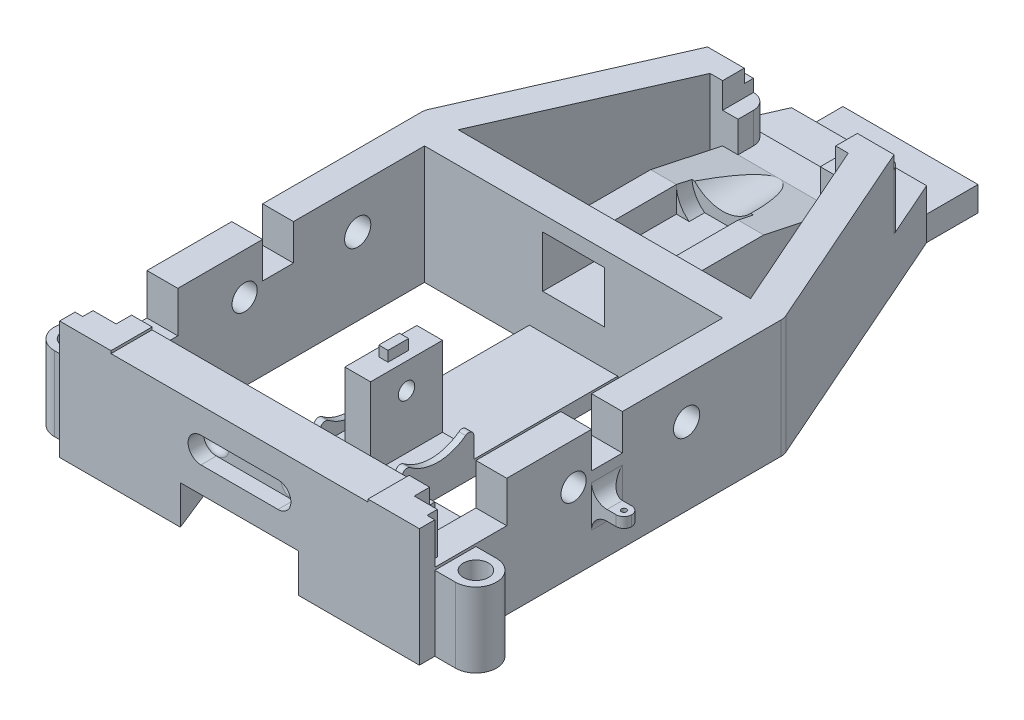
from build123d import *

# Parameters (mm, degrees)
SKETCH1_W                = 58
SKETCH1_H                = 65
BOSS_EXTRUDE1_DEPTH      = 30
BOSS_EXTRUDE3_REACH      = 92.09
SKETCH10_W               = 5
SKETCH10_H               = 14
CUT_EXTRUDE1_REACH       = 111.372
SKETCH2_R                = 2.45
SKETCH2_R_2              = 2.55
CUT_EXTRUDE2_REACH       = 91.744
SKETCH3_W                = 12
SKETCH3_H                = 10
SKETCH11_W               = 3
SKETCH11_H               = 2
BOSS_EXTRUDE4_DEPTH      = 6.3
FILLET3_R                = 1.5
SKETCH12_R               = 0.5
CUT_EXTRUDE3_DEPTH       = 92.15338732
FILLET3_OF_MIRROR1_R     = 1.5
BOSS_EXTRUDE5_REACH      = 111.564
SKETCH13_W               = 15
SKETCH13_H               = 6
BOSS_EXTRUDE6_REACH      = 111.564
SKETCH17_W               = 15
SKETCH17_H               = 14
CUT_EXTRUDE18_REACH      = 129.651
SKETCH35_W               = 16
SKETCH35_H               = 6
FILLET5_R                = 3
BOSS_EXTRUDE7_START      = 20
BOSS_EXTRUDE7_DEPTH      = 10
BOSS_EXTRUDE8_DEPTH      = 20
CUT_EXTRUDE15_REACH      = 95.637
SKETCH28_R               = 0.8
FILLET4_R                = 3
CUT_EXTRUDE16_REACH      = 96.767
SKETCH29_R               = 1.6
SKETCH30_W               = 14
SKETCH30_H               = 1.5
BOSS_EXTRUDE9_DEPTH      = 6.1
SKETCH31_W               = 1.3
SKETCH31_H               = 14
BOSS_EXTRUDE10_DEPTH     = 5
CUT_EXTRUDE17_REACH      = 99.736
FILLET11_R               = 1
FILLET11_OF_MIRROR4_R    = 1
MIRROR5_START            = -8.6
MIRROR5_OUTLINE_W        = 1.5
MIRROR5_OUTLINE_H        = 14
MIRROR5_DEPTH            = 17.2
MIRROR5_START_2          = 7.3
MIRROR5_2_DEPTH          = 1.3
SKETCH36_W               = 22
SKETCH36_H               = 15
BOSS_EXTRUDE12_DEPTH     = 14
CUT_EXTRUDE19_DEPTH      = 3
CUT_EXTRUDE20_DEPTH      = 11
CUT_EXTRUDE21_REACH      = 100.983
SKETCH41_W               = 3
SKETCH41_H               = 35
BOSS_EXTRUDE13_DEPTH     = 2
BOSS_EXTRUDE14_START     = -1.789079
SKETCH43_W               = 36.284482562
SKETCH43_H               = 9.6
BOSS_EXTRUDE14_DEPTH     = 66.789079
BOSS_EXTRUDE15_REACH     = 152.996
SKETCH44_W               = 2.842240903
SKETCH44_H               = 50
FILLET6_R                = 8
FILLET7_R                = 5
SKETCH45_W               = 17
SKETCH45_H               = 8
CUT_EXTRUDE22_DEPTH      = 166.644015889
BOSS_EXTRUDE16_REACH     = 152.29
SKETCH46_W               = 4.5
SKETCH46_H               = 5
BOSS_EXTRUDE17_START     = -30
BOSS_EXTRUDE17_DEPTH     = 30
SKETCH49_W               = 8
SKETCH49_H               = 9
CUT_EXTRUDE23_DEPTH      = 8
SKETCH50_R               = 2.45
CUT_EXTRUDE24_DEPTH      = 4.5
CUT_EXTRUDE25_START      = 13.5
SKETCH51_R               = 2.45
CUT_EXTRUDE25_DEPTH      = 4.5
BOSS_EXTRUDE18_REACH     = 165.708
SKETCH53_W               = 5
SKETCH53_H               = 10
SKETCH55_W               = 58
SKETCH55_H               = 10
BOSS_EXTRUDE20_DEPTH     = 4
CUT_EXTRUDE9_START       = -10
SKETCH19_W               = 30
SKETCH19_H               = 15
CUT_EXTRUDE9_DEPTH       = 10
SKETCH58_W               = 70
SKETCH58_H               = 9
CUT_EXTRUDE27_DEPTH      = 153.77843439
BOSS_EXTRUDE22_REACH     = 153.411
SKETCH59_W               = 30
SKETCH59_H               = 5
CUT_EXTRUDE28_REACH      = 183.113
SKETCH18_R               = 1.5
FILLET9_R                = 2
FILLET10_R               = 1
SKETCH60_W               = 70
SKETCH60_H               = 3
BOSS_EXTRUDE23_DEPTH     = 30
CUT_EXTRUDE29_DEPTH      = 7.5
CUT_EXTRUDE30_DEPTH      = 3
SKETCH64_W               = 58
SKETCH64_H               = 4
BOSS_EXTRUDE24_DEPTH     = 6
CUT_EXTRUDE31_DEPTH      = 7.5
CUT_EXTRUDE32_DEPTH      = 153.77843439
SKETCH66_W               = 26.284482562
SKETCH66_H               = 4.8
BOSS_EXTRUDE25_DEPTH     = 10
CUT_EXTRUDE33_DEPTH      = 130.30845238
CUT_EXTRUDE33_DEPTH_BACK = 130.30845238
SKETCH74_W               = 130.544253953
SKETCH74_H               = 9
SKETCH75_W               = 50
SKETCH75_H               = 0.5
CUT_EXTRUDE34_DEPTH      = 37
SKETCH76_W               = 21.333332958
SKETCH76_H               = 2.6
CUT_EXTRUDE35_DEPTH      = 128.380044971
CUT_EXTRUDE36_DEPTH      = 128.380044971
CUT_EXTRUDE36_DEPTH_BACK = 6
SKETCH77_W               = 6
SKETCH77_H               = 7
CUT_EXTRUDE37_DEPTH      = 128.380044971
CUT_EXTRUDE37_DEPTH_BACK = 6
SKETCH78_W               = 6
SKETCH78_H               = 7
CUT_EXTRUDE39_DEPTH      = 110.39801577
CUT_EXTRUDE39_DEPTH_BACK = 2.5
CUT_EXTRUDE40_DEPTH      = 3
SKETCH82_W               = 22.000000438
SKETCH82_H               = 25.54425399
CUT_EXTRUDE41_DEPTH      = 5
SKETCH83_W               = 1.8
SKETCH83_H               = 4
BOSS_EXTRUDE26_DEPTH     = 2


with BuildPart() as part:
    # Sketch1 → Boss-Extrude1 (new body)
    with BuildSketch(Plane(origin=(0, 0, 0), x_dir=(1, 0, 0), z_dir=(0, 1, 0))):
        Polygon((-35, 38.5), (-17.352941176, 78.5), (17.352941947, 78.5), (35, 38.5), (35, -38.5), (-35, -38.5), align=None)
        Rectangle(SKETCH1_W, SKETCH1_H, mode=Mode.SUBTRACT)
        Polygon((-28.44203382, 38.5), (28.442033867, 38.5), (13.442034522, 72.5), (-13.44203382, 72.5), align=None, mode=Mode.SUBTRACT)
    extrude(amount=BOSS_EXTRUDE1_DEPTH)

    # Sketch7 → Loft3 section 0
    with BuildSketch(Plane.XY.offset(-32.5)):
        with BuildLine():
            Line((-8.6, 30), (8.6, 30))
            Line((8.6, 30), (8.6, 27))
            Line((8.6, 27), (-8.6, 27))
            Line((-8.6, 27), (-8.6, 30))
        make_face()
    # Sketch8 → Loft3 section 1
    with BuildSketch(Plane.XY.offset(38.5)):
        with BuildLine():
            Line((-8.6, 30), (8.6, 30))
            Line((8.6, 30), (8.6, 27))
            Line((8.6, 27), (-8.6, 27))
            Line((-8.6, 27), (-8.6, 30))
        make_face()
    loft3 = loft()

    # Mirror3: Loft3 across plane
    add(loft3.mirror(Plane(origin=(0, 15, 0), x_dir=(0, 0, 1), z_dir=(0, -1, 0))))

    # Sketch10 → Boss-Extrude3 (add, up to next)
    with BuildSketch(Plane.XZ.offset(-27), mode=Mode.PRIVATE) as boss_extrude3_sk1:
        with Locations((0, 2.5)):
            Rectangle(SKETCH10_W, SKETCH10_H)
    boss_extrude3_tool1 = extrude(boss_extrude3_sk1.sketch, amount=BOSS_EXTRUDE3_REACH, mode=Mode.PRIVATE) - part.part
    add(boss_extrude3_tool1.solids().sort_by_distance((0, 27, 2.5))[0])

    # Sketch2 → Cut-Extrude1 (cut, up to next)
    with BuildSketch(Plane(origin=(35, 0, 0), x_dir=(0, 0, -1), z_dir=(1, 0, 0)), mode=Mode.PRIVATE) as cut_extrude1_sk1:
        with Locations((-2.5, 15)):
            Circle(SKETCH2_R)
    cut_extrude1_tool1 = extrude(cut_extrude1_sk1.sketch, amount=-CUT_EXTRUDE1_REACH, mode=Mode.PRIVATE) & part.part
    # Sketch2 → Cut-Extrude1 (cut, up to next)
    with BuildSketch(Plane(origin=(35, 0, 0), x_dir=(0, 0, -1), z_dir=(1, 0, 0)), mode=Mode.PRIVATE) as cut_extrude1_sk2:
        with Locations((19.5, 15)):
            Circle(SKETCH2_R_2)
    cut_extrude1_tool2 = extrude(cut_extrude1_sk2.sketch, amount=-CUT_EXTRUDE1_REACH, mode=Mode.PRIVATE) & part.part
    cut_extrude1_1 = cut_extrude1_tool1.solids().sort_by_distance((35, 15, 2.5))[0]
    add(cut_extrude1_1, mode=Mode.SUBTRACT)
    cut_extrude1_2 = cut_extrude1_tool2.solids().sort_by_distance((35, 15, -19.5))[0]
    add(cut_extrude1_2, mode=Mode.SUBTRACT)
    cut_extrude1 = cut_extrude1_1 + cut_extrude1_2  # Cut-Extrude1 as one shape, for the pattern or mirror that repeats it

    # Sketch3 → Cut-Extrude2 (cut, up to next)
    with BuildSketch(Plane(origin=(0, 0, -38.5), x_dir=(-1, 0, 0), z_dir=(0, 0, -1)), mode=Mode.PRIVATE) as cut_extrude2_sk1:
        with Locations((0, 15)):
            Rectangle(SKETCH3_W, SKETCH3_H)
    cut_extrude2_tool1 = extrude(cut_extrude2_sk1.sketch, amount=-CUT_EXTRUDE2_REACH, mode=Mode.PRIVATE) & part.part
    add(cut_extrude2_tool1.solids().sort_by_distance((0, 15, -38.5))[0], mode=Mode.SUBTRACT)

    # Sketch11 → Boss-Extrude4 (add)
    with BuildSketch(Plane(origin=(35, 0, 0), x_dir=(0, 0, -1), z_dir=(1, 0, 0))):
        with Locations((2.5, 20)):
            Rectangle(SKETCH11_W, SKETCH11_H)
        with Locations((2.5, 10)):
            Rectangle(SKETCH11_W, SKETCH11_H)
    boss_extrude4 = extrude(amount=BOSS_EXTRUDE4_DEPTH)

    # Fillet3
    fillet3_edges = [part.edges().sort_by_distance(p)[0] for p in [
        (41.3, 10, -1),
        (41.3, 10, -4),
        (41.3, 20, -1),
        (41.3, 20, -4),
    ]]
    fillet(fillet3_edges, radius=FILLET3_R - 0.0001)  # a hair under: the kernel refuses the full size

    # Sketch12 → Cut-Extrude3 (cut, through all)
    with BuildSketch(Plane(origin=(0, 21, 0), x_dir=(1, 0, 0), z_dir=(0, 1, 0))):
        with Locations(Location((39.8, 2.5, 0), (0, 0, 270))):
            Circle(SKETCH12_R)
    cut_extrude3 = extrude(amount=-CUT_EXTRUDE3_DEPTH, mode=Mode.SUBTRACT)

    # Mirror1: Cut-Extrude1, Boss-Extrude4, Cut-Extrude3 across plane
    add(cut_extrude1.mirror(Plane(origin=(0, 0, 0), x_dir=(0, 0, 1), z_dir=(1, 0, 0))), mode=Mode.SUBTRACT)
    add(boss_extrude4.mirror(Plane(origin=(0, 0, 0), x_dir=(0, 0, 1), z_dir=(1, 0, 0))))
    add(cut_extrude3.mirror(Plane(origin=(0, 0, 0), x_dir=(0, 0, 1), z_dir=(1, 0, 0))), mode=Mode.SUBTRACT)

    # Fillet3 of Mirror1
    fillet3_of_mirror1_edges = [part.edges().sort_by_distance(p)[0] for p in [
        (-41.3, 10, -1),
        (-41.3, 10, -4),
        (-41.3, 20, -1),
        (-41.3, 20, -4),
    ]]
    fillet(fillet3_of_mirror1_edges, radius=FILLET3_OF_MIRROR1_R - 0.0001)  # a hair under: the kernel refuses the full size

    # Sketch13 → Boss-Extrude5 (add, up to next)
    with BuildSketch(Plane(origin=(-29, 0, 0), x_dir=(0, 0, -1), z_dir=(1, 0, 0)), mode=Mode.PRIVATE) as boss_extrude5_sk1:
        with Locations((-25, 27)):
            Rectangle(SKETCH13_W, SKETCH13_H)
    boss_extrude5_tool1 = extrude(boss_extrude5_sk1.sketch, amount=BOSS_EXTRUDE5_REACH, mode=Mode.PRIVATE) - part.part
    add(boss_extrude5_tool1.solids().sort_by_distance((-29, 27, 25))[0])

    # Sketch17 → Boss-Extrude6 (add, up to next)
    with BuildSketch(Plane(origin=(-29, 0, 0), x_dir=(0, 0, -1), z_dir=(1, 0, 0)), mode=Mode.PRIVATE) as boss_extrude6_sk1:
        with Locations((-25, 7)):
            Rectangle(SKETCH17_W, SKETCH17_H)
    boss_extrude6_tool1 = extrude(boss_extrude6_sk1.sketch, amount=BOSS_EXTRUDE6_REACH, mode=Mode.PRIVATE) - part.part
    add(boss_extrude6_tool1.solids().sort_by_distance((-29, 7, 25))[0])

    # Sketch35 → Cut-Extrude18 (cut, up to next)
    with BuildSketch(Plane(origin=(0, 0, -78.5), x_dir=(-1, 0, 0), z_dir=(0, 0, -1)), mode=Mode.PRIVATE) as cut_extrude18_sk1:
        with Locations((0, 15)):
            Rectangle(SKETCH35_W, SKETCH35_H)
    cut_extrude18_tool1 = extrude(cut_extrude18_sk1.sketch, amount=-CUT_EXTRUDE18_REACH, mode=Mode.PRIVATE) & part.part
    add(cut_extrude18_tool1.solids().sort_by_distance((0, 15, -78.5))[0], mode=Mode.SUBTRACT)

    # Fillet5
    fillet5_edges = [part.edges().sort_by_distance(p)[0] for p in [
        (-35, 15, -38.5),
        (-17.352941176, 15, -78.5),
        (17.352941947, 15, -78.5),
        (35, 15, -38.5),
        (-8, 15, -78.5),
        (8, 15, -78.5),
    ]]
    fillet(fillet5_edges, radius=FILLET5_R)

    # Sketch24 → Boss-Extrude7 (add)
    with BuildSketch(Plane(origin=(0, 0, 0), x_dir=(1, 0, 0), z_dir=(0, 1, 0)).offset(BOSS_EXTRUDE7_START)):
        Polygon((9.15, 49.5), (9.15, 72.5), (6.15, 72.5), (6.15, 49.5), (-6.15, 49.5), (-6.15, 72.5), (-9.15, 72.5), (-9.15, 49.5), (-23.589092644, 49.5), (-26.23615161, 43.5), (26.23615161, 43.5), (23.589092902, 49.5), align=None)
    extrude(amount=BOSS_EXTRUDE7_DEPTH)

    # Sketch26 → Boss-Extrude8 (add)
    with BuildSketch(Plane(origin=(0, 0, -38.5), x_dir=(-1, 0, 0), z_dir=(0, 0, -1))):
        Polygon((-11, 5), (-11, 0), (11, 0), (11, 5), (11, 15), (6, 15), (6, 10), (-6, 10), (-6, 15), (-11, 15), align=None)
    extrude(amount=BOSS_EXTRUDE8_DEPTH)

    # Sketch28 → Cut-Extrude15 (cut, up to next)
    with BuildSketch(Plane(origin=(0, 30, 0), x_dir=(-1, 0, 0), z_dir=(0, 1, 0)), mode=Mode.PRIVATE) as cut_extrude15_sk1:
        with Locations(Location((0, -46.5, 0), (0, 0, 90))):
            Circle(SKETCH28_R)
    cut_extrude15_tool1 = extrude(cut_extrude15_sk1.sketch, amount=-CUT_EXTRUDE15_REACH, mode=Mode.PRIVATE) & part.part
    # Sketch28 → Cut-Extrude15 (cut, up to next)
    with BuildSketch(Plane(origin=(0, 30, 0), x_dir=(-1, 0, 0), z_dir=(0, 1, 0)), mode=Mode.PRIVATE) as cut_extrude15_sk2:
        with Locations(Location((0, -75.5, 0), (0, 0, 90))):
            Circle(SKETCH28_R)
    cut_extrude15_tool2 = extrude(cut_extrude15_sk2.sketch, amount=-CUT_EXTRUDE15_REACH, mode=Mode.PRIVATE) & part.part
    add(cut_extrude15_tool1.solids().sort_by_distance((0, 30, -46.5))[0], mode=Mode.SUBTRACT)
    add(cut_extrude15_tool2.solids().sort_by_distance((0, 30, -75.5))[0], mode=Mode.SUBTRACT)

    # Fillet4
    fillet4_edges = [part.edges().sort_by_distance(p)[0] for p in [
        (35, 19, -2.5),
        (35, 20, -4),
        (35, 21, -2.5),
        (35, 11, -2.5),
        (35, 9, -2.5),
        (35, 10, -4),
        (-35, 19, -2.5),
        (-35, 20, -4),
        (-35, 21, -2.5),
        (-35, 11, -2.5),
        (-35, 9, -2.5),
        (-35, 10, -4),
    ]]
    fillet(fillet4_edges, radius=FILLET4_R)

    # Sketch29 → Cut-Extrude16 (cut, up to next)
    with BuildSketch(Plane(origin=(2.5, 0, 0), x_dir=(0, 0, -1), z_dir=(1, 0, 0)), mode=Mode.PRIVATE) as cut_extrude16_sk1:
        with Locations(Location((-2.5, 15, 0), (0, 0, 90))):
            Circle(SKETCH29_R)
    cut_extrude16_tool1 = extrude(cut_extrude16_sk1.sketch, amount=-CUT_EXTRUDE16_REACH, mode=Mode.PRIVATE) & part.part
    add(cut_extrude16_tool1.solids().sort_by_distance((2.5, 15, 2.5))[0], mode=Mode.SUBTRACT)

    # Sketch30 → Boss-Extrude9 (add)
    with BuildSketch(Plane.ZY.offset(2.5)):
        with Locations((2.5, 26.25)):
            Rectangle(SKETCH30_W, SKETCH30_H)
    boss_extrude9 = extrude(amount=BOSS_EXTRUDE9_DEPTH)

    # Sketch31 → Boss-Extrude10 (add)
    with BuildSketch(Plane.XZ.offset(-25.5)):
        with Locations((-7.95, 2.5)):
            Rectangle(SKETCH31_W, SKETCH31_H)
    boss_extrude10 = extrude(amount=BOSS_EXTRUDE10_DEPTH)

    # Sketch32 → Cut-Extrude17 (cut, up to next)
    with BuildSketch(Plane.ZY.offset(8.6), mode=Mode.PRIVATE) as cut_extrude17_sk1:
        with BuildLine():
            Line((-4.5, 20.5), (-4.5, 20.656854249))
            ThreePointArc((-4.5, 20.656854249), (2.5, 24), (9.5, 20.656854249))
            Line((9.5, 20.656854249), (9.5, 20.5))
            Line((9.5, 20.5), (-4.5, 20.5))
        make_face()
    cut_extrude17_tool1 = extrude(cut_extrude17_sk1.sketch, amount=-CUT_EXTRUDE17_REACH, mode=Mode.PRIVATE) & part.part
    cut_extrude17 = cut_extrude17_tool1.solids().sort_by_distance((-8.6, 21.927092, 2.5))[0]
    add(cut_extrude17, mode=Mode.SUBTRACT)

    # Fillet11
    fillet11_edges = [part.edges().sort_by_distance(p)[0] for p in [
        (-7.95, 20.656854249, 9.5),
        (-7.95, 20.656854249, -4.5),
    ]]
    fillet(fillet11_edges, radius=FILLET11_R)

    # Mirror4: Boss-Extrude9, Boss-Extrude10, Cut-Extrude17 across plane
    add(boss_extrude9.mirror(Plane(origin=(0, 15, 0), x_dir=(0, 0, 1), z_dir=(0, -1, 0))))
    add(boss_extrude10.mirror(Plane(origin=(0, 15, 0), x_dir=(0, 0, 1), z_dir=(0, -1, 0))))
    add(cut_extrude17.mirror(Plane(origin=(0, 15, 0), x_dir=(0, 0, 1), z_dir=(0, -1, 0))), mode=Mode.SUBTRACT)

    # Fillet11 of Mirror4
    fillet11_of_mirror4_edges = [part.edges().sort_by_distance(p)[0] for p in [
        (-7.95, 9.343145751, 9.5),
        (-7.95, 9.343145751, -4.5),
    ]]
    fillet(fillet11_of_mirror4_edges, radius=FILLET11_OF_MIRROR4_R)

    # Mirror5: read off the stored shape, not the designer's step
    # Mirror5 outline → Mirror5 (add)
    with BuildSketch(Plane.YZ.offset(MIRROR5_START)):
        with Locations((3.75, 2.5)):
            Rectangle(MIRROR5_OUTLINE_W, MIRROR5_OUTLINE_H)
        with Locations((26.25, 2.5)):
            Rectangle(MIRROR5_OUTLINE_W, MIRROR5_OUTLINE_H)
    extrude(amount=MIRROR5_DEPTH)

    # Mirror5 2 outline → Mirror5 2 (add)
    with BuildSketch(Plane.YZ.offset(MIRROR5_START_2)):
        with BuildLine():
            Line((7, 9.5), (4.5, 9.5))
            Line((4.5, 9.5), (4.5, -4.5))
            Line((4.5, -4.5), (7, -4.5))
            ThreePointArc((7, -4.5), (7.894427191, -3.947213595), (7.8, -2.9))
            ThreePointArc((7.8, -2.9), (6, 2.5), (7.8, 7.9))
            ThreePointArc((7.8, 7.9), (7.894427191, 8.947213595), (7, 9.5))
        make_face()
        with BuildLine():
            Line((25.5, 9.5), (23, 9.5))
            ThreePointArc((23, 9.5), (22.105572809, 8.947213595), (22.2, 7.9))
            ThreePointArc((22.2, 7.9), (24, 2.5), (22.2, -2.9))
            ThreePointArc((22.2, -2.9), (22.105572809, -3.947213595), (23, -4.5))
            Line((23, -4.5), (25.5, -4.5))
            Line((25.5, -4.5), (25.5, 9.5))
        make_face()
    extrude(amount=MIRROR5_2_DEPTH)

    # Sketch36 → Boss-Extrude12 (add)
    with BuildSketch(Plane(origin=(0, 0, -58.5), x_dir=(-1, 0, 0), z_dir=(0, 0, -1))):
        with Locations((0, 7.5)):
            Rectangle(SKETCH36_W, SKETCH36_H)
    extrude(amount=BOSS_EXTRUDE12_DEPTH)

    # Sketch37 → Cut-Extrude19 (cut)
    with BuildSketch(Plane.XY.offset(-58.5)):
        with BuildLine():
            Line((-6, 15), (6, 15))
            ThreePointArc((6, 15), (5.340169944, 12.204915028), (3.5, 10))
            Line((3.5, 10), (-3.5, 10))
            ThreePointArc((-3.5, 10), (-5.340169944, 12.204915028), (-6, 15))
        make_face()
    extrude(amount=-CUT_EXTRUDE19_DEPTH, mode=Mode.SUBTRACT)

    # Sketch38 → Cut-Extrude20 (cut)
    with BuildSketch(Plane.XY.offset(-61.5)):
        with BuildLine():
            Line((-6, 15), (6, 15))
            ThreePointArc((6, 15), (0, 12), (-6, 15))
        make_face()
    extrude(amount=-CUT_EXTRUDE20_DEPTH, mode=Mode.SUBTRACT)

    # Cut-Extrude21: up to this face of the body (flat: up to its plane)
    cut_extrude21_end = Plane(part.part.faces().sort_by_distance((11, 7.5, -55.5))[0])
    # Sketch40 → Cut-Extrude21 (cut, up to the picked face)
    with BuildSketch(Plane.ZY.offset(11), mode=Mode.PRIVATE) as cut_extrude21_sk1:
        Polygon((-58.5, 15), (-72.5, 15), (-72.5, 12), align=None)
    cut_extrude21_tool1 = split(extrude(cut_extrude21_sk1.sketch, amount=-CUT_EXTRUDE21_REACH, mode=Mode.PRIVATE), bisect_by=cut_extrude21_end, keep=Keep.BOTH, mode=Mode.PRIVATE)
    add(cut_extrude21_tool1.solids().sort_by(Axis((-11, 14, -67.833333), (1, 0, 0)))[0], mode=Mode.SUBTRACT)

    # Sketch41 → Boss-Extrude13 (add)
    with BuildSketch(Plane(origin=(0, 30, 0), x_dir=(1, 0, 0), z_dir=(0, 1, 0))):
        with Locations((-7.65, 61)):
            Rectangle(SKETCH41_W, SKETCH41_H)
        with Locations((7.65, 61)):
            Rectangle(SKETCH41_W, SKETCH41_H)
    extrude(amount=BOSS_EXTRUDE13_DEPTH)

    # Sketch43 → Boss-Extrude14 (add)
    with BuildSketch(Plane(origin=(0, 0, -78.5), x_dir=(-1, 0, 0), z_dir=(0, 0, -1)).offset(BOSS_EXTRUDE14_START)):
        with Locations((-3.78e-07, 4.8)):
            Rectangle(SKETCH43_W, SKETCH43_H)
        with Locations((-3.78e-07, 25.2)):
            Rectangle(SKETCH43_W, SKETCH43_H)
    extrude(amount=BOSS_EXTRUDE14_DEPTH)

    # Sketch44 → Boss-Extrude15 (add, up to next)
    with BuildSketch(Plane(origin=(0, 9.6, 0), x_dir=(1, 0, 0), z_dir=(0, 1, 0)), mode=Mode.PRIVATE) as boss_extrude15_sk1:
        with Locations((-16.721120451, 118.5)):
            Rectangle(SKETCH44_W, SKETCH44_H)
    boss_extrude15_tool1 = extrude(boss_extrude15_sk1.sketch, amount=BOSS_EXTRUDE15_REACH, mode=Mode.PRIVATE) - part.part
    # Sketch44 → Boss-Extrude15 (add, up to next)
    with BuildSketch(Plane(origin=(0, 9.6, 0), x_dir=(1, 0, 0), z_dir=(0, 1, 0)), mode=Mode.PRIVATE) as boss_extrude15_sk2:
        Polygon((18.142241659, 143.5), (15.3, 143.5), (15.3, 93.5), (18.142240903, 93.5), align=None)
    boss_extrude15_tool2 = extrude(boss_extrude15_sk2.sketch, amount=BOSS_EXTRUDE15_REACH, mode=Mode.PRIVATE) - part.part
    add(boss_extrude15_tool1.solids().sort_by_distance((-16.72112, 9.6, -118.5))[0])
    add(boss_extrude15_tool2.solids().sort_by_distance((16.721121, 9.6, -118.500001))[0])

    # Fillet6
    fillet6_edges = [part.edges().sort_by_distance(p)[0] for p in [
        (3.78e-07, 0, -143.5),
        (3.78e-07, 30, -143.5),
    ]]
    fillet(fillet6_edges, radius=FILLET6_R)

    # Fillet7
    # the kernel refuses this fillet: 5 mm, written as the material it takes off along each edge
    with BuildSketch(Plane(origin=(18.142241659, 0, -64.210921), x_dir=(-1, 0, 0), z_dir=(0, 0, -1))) as fillet7_piece_1_section:
        with BuildLine():
            CenterArc((FILLET7_R, FILLET7_R), FILLET7_R, 180, 90)
            Line((0, FILLET7_R), (0, 0))
            Line((0, 0), (FILLET7_R, 0))
        make_face()
    fillet7_piece_1 = extrude(amount=71.289079, mode=Mode.PRIVATE)
    fillet7_piece_1 = split(fillet7_piece_1, bisect_by=Plane(origin=(22.758461497, 0, -66.247488486), z_dir=(0.9149178080838143, 0, -0.4036401918182936)), keep=Keep.TOP, mode=Mode.PRIVATE)
    with BuildSketch(Plane(origin=(18.142241659, 8, -135.5), x_dir=(0, 0, -1), z_dir=(0, 1, 0))) as fillet7_piece_2:
        with BuildLine():
            CenterArc((8 - FILLET7_R, FILLET7_R), FILLET7_R, 270, 90)
            Line((8 - FILLET7_R, 0), (8, 0))
            Line((8, 0), (8, FILLET7_R))
        make_face()
    fillet7_piece_2_solid = revolve(axis=Axis((18.142241659, 8, -135.5), (-1, 0, 0)), revolution_arc=90, mode=Mode.PRIVATE)
    with BuildSketch(Plane(origin=(18.142241659, 9.6, -143.5), x_dir=(-1, 0, 0), z_dir=(0, 1, 0))) as fillet7_piece_3:
        with BuildLine():
            CenterArc((FILLET7_R * 1.00000001512, FILLET7_R), FILLET7_R, 179.999999134, 90.000000866)
            Line((FILLET7_R * 1.511713279e-08, FILLET7_R * 1.00000001512), (0, 0))
            Line((0, 0), (FILLET7_R * 1.00000001512, 0))
        make_face()
    fillet7_piece_3_solid = extrude(amount=10.8, mode=Mode.PRIVATE)
    with BuildSketch(Plane(origin=(18.142241659, 22, -135.5), x_dir=(0, 1, 0), z_dir=(0, 0, 1))) as fillet7_piece_4:
        with BuildLine():
            CenterArc((8 - FILLET7_R, FILLET7_R), FILLET7_R, 270, 90)
            Line((8 - FILLET7_R, 0), (8, 0))
            Line((8, 0), (8, FILLET7_R))
        make_face()
    fillet7_piece_4_solid = revolve(axis=Axis((18.142241659, 22, -135.5), (-1, 0, 0)), revolution_arc=90, mode=Mode.PRIVATE)
    with BuildSketch(Plane(origin=(-18.142240903, 0, -64.210921), x_dir=(0, 1, 0), z_dir=(0, 0, -1))) as fillet7_piece_5_section:
        with BuildLine():
            CenterArc((FILLET7_R, FILLET7_R), FILLET7_R, 180, 90)
            Line((0, FILLET7_R), (0, 0))
            Line((0, 0), (FILLET7_R, 0))
        make_face()
    fillet7_piece_5 = extrude(amount=71.289079, mode=Mode.PRIVATE)
    fillet7_piece_5 = split(fillet7_piece_5, bisect_by=Plane(origin=(-22.758460893, 0, -66.247488643), z_dir=(-0.914917801572932, 0, -0.40364020657629374)), keep=Keep.TOP, mode=Mode.PRIVATE)
    with BuildSketch(Plane(origin=(-18.142240903, 8, -135.5), x_dir=(0, 0, -1), z_dir=(0, 1, 0))) as fillet7_piece_6:
        with BuildLine():
            CenterArc((8 - FILLET7_R, -FILLET7_R), FILLET7_R, 0, 90)
            Line((8, -FILLET7_R), (8, 0))
            Line((8, 0), (8 - FILLET7_R, 0))
        make_face()
    fillet7_piece_6_solid = revolve(axis=Axis((-18.142240903, 8, -135.5), (-1, 0, 0)), revolution_arc=90, mode=Mode.PRIVATE)
    with BuildSketch(Plane(origin=(-18.142240903, 22, -143.5), x_dir=(0, 0, 1), z_dir=(0, -1, 0))) as fillet7_piece_7:
        with BuildLine():
            CenterArc((FILLET7_R, -FILLET7_R), FILLET7_R, 90, 90)
            Line((0, -FILLET7_R), (0, 0))
            Line((0, 0), (FILLET7_R, 0))
        make_face()
    fillet7_piece_7_solid = extrude(amount=14, mode=Mode.PRIVATE)
    with BuildSketch(Plane(origin=(-18.142240903, 22, -135.5), x_dir=(0, 1, 0), z_dir=(0, 0, 1))) as fillet7_piece_8:
        with BuildLine():
            CenterArc((8 - FILLET7_R, -FILLET7_R), FILLET7_R, 0, 90)
            Line((8, -FILLET7_R), (8, 0))
            Line((8, 0), (8 - FILLET7_R, 0))
        make_face()
    fillet7_piece_8_solid = revolve(axis=Axis((-18.142240903, 22, -135.5), (-1, 0, 0)), revolution_arc=90, mode=Mode.PRIVATE)
    with BuildSketch(Plane(origin=(18.142241659, 30, -64.210921), x_dir=(-1, 0, 0), z_dir=(0, 0, -1))) as fillet7_piece_9_section:
        with BuildLine():
            CenterArc((FILLET7_R, -FILLET7_R), FILLET7_R, 90, 90)
            Line((0, -FILLET7_R), (0, 0))
            Line((0, 0), (FILLET7_R, 0))
        make_face()
    fillet7_piece_9 = extrude(amount=71.289079, mode=Mode.PRIVATE)
    fillet7_piece_9 = split(fillet7_piece_9, bisect_by=Plane(origin=(22.758461497, 30, -66.247488486), z_dir=(0.9149178080838143, 0, -0.4036401918182936)), keep=Keep.TOP, mode=Mode.PRIVATE)
    with BuildSketch(Plane(origin=(-18.142240903, 30, -64.210921), x_dir=(1, 0, 0), z_dir=(0, 0, -1))) as fillet7_piece_10_section:
        with BuildLine():
            CenterArc((FILLET7_R, FILLET7_R), FILLET7_R, 180, 90)
            Line((0, FILLET7_R), (0, 0))
            Line((0, 0), (FILLET7_R, 0))
        make_face()
    fillet7_piece_10 = extrude(amount=71.289079, mode=Mode.PRIVATE)
    fillet7_piece_10 = split(fillet7_piece_10, bisect_by=Plane(origin=(-22.758460893, 30, -66.247488643), z_dir=(-0.914917801572932, 0, -0.40364020657629374)), keep=Keep.TOP, mode=Mode.PRIVATE)
    with BuildSketch(Plane(origin=(18.142241659, 20.4, -143.5), x_dir=(0, 0, 1), z_dir=(0, 1, 0)), Plane(origin=(18.142241659, 9.6, -143.5), x_dir=(-1, 0, 0), z_dir=(0, -1, 0))) as fillet7_piece_11:
        with BuildLine():
            CenterArc((FILLET7_R, -FILLET7_R), FILLET7_R, 90, 90)
            Line((0, -FILLET7_R), (0, 0))
            Line((0, 0), (FILLET7_R, 0))
        make_face()
    fillet7_piece_11_solid = extrude(amount=1.6, mode=Mode.PRIVATE)
    add([fillet7_piece_1, fillet7_piece_2_solid, fillet7_piece_3_solid, fillet7_piece_4_solid, fillet7_piece_5, fillet7_piece_6_solid, fillet7_piece_7_solid, fillet7_piece_8_solid, fillet7_piece_9, fillet7_piece_10, fillet7_piece_11_solid], mode=Mode.SUBTRACT)

    # Sketch45 → Cut-Extrude22 (cut, through all)
    with BuildSketch(Plane(origin=(35, 0, 0), x_dir=(0, 0, -1), z_dir=(1, 0, 0))):
        with Locations((-24, 19)):
            Rectangle(SKETCH45_W, SKETCH45_H)
    extrude(amount=-CUT_EXTRUDE22_DEPTH, mode=Mode.SUBTRACT)

    # Sketch46 → Boss-Extrude16 (add, up to next)
    with BuildSketch(Plane(origin=(0, 15, 0), x_dir=(1, 0, 0), z_dir=(0, 1, 0)), mode=Mode.PRIVATE) as boss_extrude16_sk1:
        with Locations((31.25, -30)):
            Rectangle(SKETCH46_W, SKETCH46_H)
    boss_extrude16_tool1 = extrude(boss_extrude16_sk1.sketch, amount=BOSS_EXTRUDE16_REACH, mode=Mode.PRIVATE) - part.part
    boss_extrude16 = boss_extrude16_tool1.solids().sort_by_distance((31.25, 15, 30))[0]
    add(boss_extrude16)

    # Sketch48 → Boss-Extrude17 (add)
    with BuildSketch(Plane.XZ.offset(BOSS_EXTRUDE17_START)):
        with BuildLine():
            Line((35, 29.5), (39, 29.5))
            ThreePointArc((39, 29.5), (43, 25.5), (39, 21.5))
            Line((39, 21.5), (35, 21.5))
            Line((35, 21.5), (35, 29.5))
        make_face()
    boss_extrude17 = extrude(amount=BOSS_EXTRUDE17_DEPTH)

    # Sketch49 → Cut-Extrude23 (cut)
    with BuildSketch(Plane.XY.offset(29.5)):
        with Locations((39, 19)):
            Rectangle(SKETCH49_W, SKETCH49_H)
    cut_extrude23 = extrude(amount=-CUT_EXTRUDE23_DEPTH, mode=Mode.SUBTRACT)

    # Sketch50 → Cut-Extrude24 (cut)
    with BuildSketch(Plane(origin=(0, 14.5, 0), x_dir=(1, 0, 0), z_dir=(0, 1, 0))):
        with Locations(Location((39, -25.5, 0), (0, 0, 270))):
            Circle(SKETCH50_R)
    cut_extrude24 = extrude(amount=-CUT_EXTRUDE24_DEPTH, mode=Mode.SUBTRACT)

    # Sketch51 → Cut-Extrude25 (cut)
    with BuildSketch(Plane(origin=(0, 14.5, 0), x_dir=(1, 0, 0), z_dir=(0, 1, 0)).offset(CUT_EXTRUDE25_START)):
        with Locations(Location((39, -25.5, 0), (0, 0, 270))):
            Circle(SKETCH51_R)
    cut_extrude25 = extrude(amount=-CUT_EXTRUDE25_DEPTH, mode=Mode.SUBTRACT)

    # Mirror7: Boss-Extrude16, Boss-Extrude17, Cut-Extrude23, Cut-Extrude24, Cut-Extrude25 across plane
    add(boss_extrude16.mirror(Plane(origin=(0, 0, 0), x_dir=(0, 0, 1), z_dir=(1, 0, 0))))
    add(boss_extrude17.mirror(Plane(origin=(0, 0, 0), x_dir=(0, 0, 1), z_dir=(1, 0, 0))))
    add(cut_extrude23.mirror(Plane(origin=(0, 0, 0), x_dir=(0, 0, 1), z_dir=(1, 0, 0))), mode=Mode.SUBTRACT)
    add(cut_extrude24.mirror(Plane(origin=(0, 0, 0), x_dir=(0, 0, 1), z_dir=(1, 0, 0))), mode=Mode.SUBTRACT)
    add(cut_extrude25.mirror(Plane(origin=(0, 0, 0), x_dir=(0, 0, 1), z_dir=(1, 0, 0))), mode=Mode.SUBTRACT)

    # Sketch53 → Boss-Extrude18 (add, up to next)
    with BuildSketch(Plane.ZY.offset(-29), mode=Mode.PRIVATE) as boss_extrude18_sk1:
        with Locations((30, 19)):
            Rectangle(SKETCH53_W, SKETCH53_H)
    boss_extrude18_tool1 = extrude(boss_extrude18_sk1.sketch, amount=BOSS_EXTRUDE18_REACH, mode=Mode.PRIVATE) - part.part
    add(boss_extrude18_tool1.solids().sort_by_distance((29, 19, 30))[0])

    # Sketch55 → Boss-Extrude20 (add)
    with BuildSketch(Plane(origin=(0, 0, 27.5), x_dir=(-1, 0, 0), z_dir=(0, 0, -1))):
        with Locations((0, 19)):
            Rectangle(SKETCH55_W, SKETCH55_H)
    extrude(amount=BOSS_EXTRUDE20_DEPTH)

    # Sketch19 → Cut-Extrude9 (cut)
    with BuildSketch(Plane(origin=(0, 30, 0), x_dir=(1, 0, 0), z_dir=(0, 1, 0)).offset(CUT_EXTRUDE9_START)):
        with Locations((0, -25)):
            Rectangle(SKETCH19_W, SKETCH19_H)
    extrude(amount=-CUT_EXTRUDE9_DEPTH, mode=Mode.SUBTRACT)

    # Sketch58 → Cut-Extrude27 (cut, through all)
    with BuildSketch(Plane(origin=(0, 30, 0), x_dir=(1, 0, 0), z_dir=(0, 1, 0))):
        with Locations((0, -34)):
            Rectangle(SKETCH58_W, SKETCH58_H)
    extrude(amount=-CUT_EXTRUDE27_DEPTH, mode=Mode.SUBTRACT)

    # Sketch59 → Boss-Extrude22 (add, up to next)
    with BuildSketch(Plane(origin=(0, 10, 0), x_dir=(1, 0, 0), z_dir=(0, 1, 0)), mode=Mode.PRIVATE) as boss_extrude22_sk1:
        with Locations((0, -27)):
            Rectangle(SKETCH59_W, SKETCH59_H)
    boss_extrude22_tool1 = extrude(boss_extrude22_sk1.sketch, amount=BOSS_EXTRUDE22_REACH, mode=Mode.PRIVATE) - part.part
    add(boss_extrude22_tool1.solids().sort_by_distance((0, 10, 27))[0])

    # Sketch18 → Cut-Extrude28 (cut, up to next)
    with BuildSketch(Plane.XY.offset(29.5), mode=Mode.PRIVATE) as cut_extrude28_sk1:
        with Locations((7.5, 15)):
            Circle(SKETCH18_R)
    cut_extrude28_tool1 = extrude(cut_extrude28_sk1.sketch, amount=-CUT_EXTRUDE28_REACH, mode=Mode.PRIVATE) & part.part
    # Sketch18 → Cut-Extrude28 (cut, up to next)
    with BuildSketch(Plane.XY.offset(29.5), mode=Mode.PRIVATE) as cut_extrude28_sk2:
        with Locations((-7.5, 15)):
            Circle(SKETCH18_R)
    cut_extrude28_tool2 = extrude(cut_extrude28_sk2.sketch, amount=-CUT_EXTRUDE28_REACH, mode=Mode.PRIVATE) & part.part
    add(cut_extrude28_tool1.solids().sort_by_distance((7.5, 15, 29.5))[0], mode=Mode.SUBTRACT)
    add(cut_extrude28_tool2.solids().sort_by_distance((-7.5, 15, 29.5))[0], mode=Mode.SUBTRACT)

    # Fillet9
    fillet9_edges = [part.edges().sort_by_distance(p)[0] for p in [
        (6, 15, 24.5),
        (-9, 15, 24.5),
    ]]
    fillet(fillet9_edges, radius=FILLET9_R)

    # Fillet10
    fillet10_edges = [part.edges().sort_by_distance(p)[0] for p in [
        (6, 15, 29.5),
        (-9, 15, 29.5),
    ]]
    fillet(fillet10_edges, radius=FILLET10_R)

    # Sketch60 → Boss-Extrude23 (add)
    with BuildSketch(Plane.XZ):
        with Locations((0, 31)):
            Rectangle(SKETCH60_W, SKETCH60_H)
    extrude(amount=-BOSS_EXTRUDE23_DEPTH)

    # Sketch61 → Cut-Extrude29 (cut)
    with BuildSketch(Plane.XZ):
        Polygon((11.5, 32.5), (-11.5, 32.5), (-14.5, 25), (14.5, 25), align=None)
    extrude(amount=-CUT_EXTRUDE29_DEPTH, mode=Mode.SUBTRACT)

    # Sketch62 → Cut-Extrude30 (cut)
    with BuildSketch(Plane.XY.offset(32.5)):
        with BuildLine():
            Line((-7.5, 17.5), (7.5, 17.5))
            ThreePointArc((7.5, 17.5), (10, 15), (7.5, 12.5))
            Line((7.5, 12.5), (-7.5, 12.5))
            ThreePointArc((-7.5, 12.5), (-10, 15), (-7.5, 17.5))
        make_face()
    extrude(amount=-CUT_EXTRUDE30_DEPTH, mode=Mode.SUBTRACT)

    # Sketch64 → Boss-Extrude24 (add)
    with BuildSketch(Plane(origin=(0, 0, 23.5), x_dir=(-1, 0, 0), z_dir=(0, 0, -1))):
        with Locations((0, 22)):
            Rectangle(SKETCH64_W, SKETCH64_H)
    extrude(amount=BOSS_EXTRUDE24_DEPTH)

    # Sketch63 → Cut-Extrude31 (cut)
    with BuildSketch(Plane(origin=(0, 30, 0), x_dir=(1, 0, 0), z_dir=(0, 1, 0))):
        Polygon((-11.5, -32.5), (11.5, -32.5), (14.5, -25), (-14.5, -25), align=None)
    extrude(amount=-CUT_EXTRUDE31_DEPTH, mode=Mode.SUBTRACT)

    # Sketch65 → Cut-Extrude32 (cut, through all)
    with BuildSketch(Plane(origin=(0, 30, 0), x_dir=(1, 0, 0), z_dir=(0, 1, 0))):
        Polygon((-13.142240903, 88.044253953), (13.142241659, 88.044254404), (18.142241659, 76.710920576), (18.142241659, 143.5), (-18.142240903, 143.5), (-18.142240903, 76.71092062), align=None)
    extrude(amount=-CUT_EXTRUDE32_DEPTH, mode=Mode.SUBTRACT)

    # Sketch66 → Boss-Extrude25 (add)
    with BuildSketch(Plane(origin=(-1.51e-06, 0, -88.044254178), x_dir=(-0.9999999999999999, 0, 1.7148916448299635e-08), z_dir=(-1.7148916448299635e-08, 0, -0.9999999999999999))):
        with Locations((-1.888e-06, 27.6)):
            Rectangle(SKETCH66_W, SKETCH66_H)
        with Locations((-1.888e-06, 2.4)):
            Rectangle(SKETCH66_W, SKETCH66_H)
    extrude(amount=BOSS_EXTRUDE25_DEPTH)

    # Sketch74 → Cut-Extrude33 (cut, two sides: drawn at the far end of the back side and taken through both)
    with BuildSketch(Plane.ZY.offset(35).offset(-CUT_EXTRUDE33_DEPTH_BACK)):
        with Locations((-32.772126977, 27.5)):
            Rectangle(SKETCH74_W, SKETCH74_H)
    extrude(amount=CUT_EXTRUDE33_DEPTH + CUT_EXTRUDE33_DEPTH_BACK, mode=Mode.SUBTRACT)


with BuildPart() as cut_extrude33_piece_1:
    # of the separate pieces the step leaves, piece 1, a body of its own (cut_extrude33_pieces)
    add(part.part.solids().sort_by_distance((9, 15, 28.5))[0])


with BuildPart() as cut_extrude33_piece_2:
    # of the separate pieces the step leaves, piece 2, a body of its own (cut_extrude33_pieces)
    add(part.part.solids().sort_by_distance((-8.6, 23, 9.5))[0])


with BuildPart() as cut_extrude33_piece_3:
    # of the separate pieces the step leaves, piece 3, a body of its own (cut_extrude33_pieces)
    add(part.part.solids().sort_by_distance((-8.6, 23, -1.623105626))[0])


with BuildPart() as cut_extrude33_piece_4:
    # of the separate pieces the step leaves, piece 4, a body of its own (cut_extrude33_pieces)
    add(part.part.solids().sort_by_distance((8.6, 23, 9.5))[0])


with BuildPart() as cut_extrude33_piece_5:
    # of the separate pieces the step leaves, piece 5, a body of its own (cut_extrude33_pieces)
    add(part.part.solids().sort_by_distance((8.6, 23, -4.5))[0])


with BuildPart() as cut_extrude34_tool:
    # Sketch75 → Cut-Extrude34 (new body)
    with BuildSketch(Plane.XY.offset(32.5)):
        with Locations((0, 22.75)):
            Rectangle(SKETCH75_W, SKETCH75_H)
    extrude(amount=-CUT_EXTRUDE34_DEPTH)


with BuildPart() as cut_extrude33_piece_1_1:
    add(cut_extrude33_piece_1.part)

    # Cut-Extrude34: cut by cut_extrude34_tool
    add(cut_extrude34_tool.part, mode=Mode.SUBTRACT)

    # Sketch76 → Cut-Extrude35 (cut, through all)
    with BuildSketch(Plane.ZY.offset(35)):
        with Locations((-87.377587099, 21.7)):
            Rectangle(SKETCH76_W, SKETCH76_H)
    extrude(amount=-CUT_EXTRUDE35_DEPTH, mode=Mode.SUBTRACT)

    # Sketch77 → Cut-Extrude36 (cut, two sides: drawn at the far end of the back side and taken through both)
    with BuildSketch(Plane.ZY.offset(35).offset(-CUT_EXTRUDE36_DEPTH_BACK)):
        with Locations((-4, 19.5)):
            Rectangle(SKETCH77_W, SKETCH77_H)
    extrude(amount=CUT_EXTRUDE36_DEPTH + CUT_EXTRUDE36_DEPTH_BACK, mode=Mode.SUBTRACT)

    # Sketch78 → Cut-Extrude37 (cut, two sides: drawn at the far end of the back side and taken through both)
    with BuildSketch(Plane(origin=(35, 0, 0), x_dir=(0, 0, -1), z_dir=(1, 0, 0)).offset(-CUT_EXTRUDE37_DEPTH_BACK)):
        with Locations((4, 19.5)):
            Rectangle(SKETCH78_W, SKETCH78_H)
    extrude(amount=CUT_EXTRUDE37_DEPTH + CUT_EXTRUDE37_DEPTH_BACK, mode=Mode.SUBTRACT)


with BuildPart() as cut_extrude33_piece_2_1:
    add(cut_extrude33_piece_2.part)

    # Cut-Extrude34: cut by cut_extrude34_tool
    add(cut_extrude34_tool.part, mode=Mode.SUBTRACT)


with BuildPart() as cut_extrude33_piece_3_1:
    add(cut_extrude33_piece_3.part)

    # Cut-Extrude34: cut by cut_extrude34_tool
    add(cut_extrude34_tool.part, mode=Mode.SUBTRACT)


with BuildPart() as cut_extrude33_piece_4_1:
    add(cut_extrude33_piece_4.part)

    # Cut-Extrude34: cut by cut_extrude34_tool
    add(cut_extrude34_tool.part, mode=Mode.SUBTRACT)


with BuildPart() as cut_extrude33_piece_5_1:
    add(cut_extrude33_piece_5.part)

    # Cut-Extrude34: cut by cut_extrude34_tool
    add(cut_extrude34_tool.part, mode=Mode.SUBTRACT)


with BuildPart() as cut_extrude39_tool:
    # Sketch80 → Cut-Extrude39 (new, two sides: drawn at the far end of the back side and taken through both)
    with BuildSketch(Plane(origin=(0, 22.5, 0), x_dir=(1, 0, 0), z_dir=(0, 1, 0)).offset(-CUT_EXTRUDE39_DEPTH_BACK)):
        Polygon((-2.5, -24.5), (29, -24.5), (29, 7), (-29, 7), (-29, -24.5), align=None)
    extrude(amount=CUT_EXTRUDE39_DEPTH + CUT_EXTRUDE39_DEPTH_BACK)


with BuildPart() as cut_extrude33_piece_1_2:
    add(cut_extrude33_piece_1_1.part)

    # Cut-Extrude39: cut by cut_extrude39_tool
    add(cut_extrude39_tool.part, mode=Mode.SUBTRACT)

    # Sketch81 → Cut-Extrude40 (cut)
    with BuildSketch(Plane(origin=(0, 23, 0), x_dir=(1, 0, 0), z_dir=(0, 1, 0))):
        Polygon((-13.44203382, 72.5), (13.442034522, 72.5), (26.23615161, 43.5), (-26.236151467, 43.5), align=None)
    extrude(amount=-CUT_EXTRUDE40_DEPTH, mode=Mode.SUBTRACT)

    # Sketch82 → Cut-Extrude41 (cut)
    with BuildSketch(Plane(origin=(0, 23, 0), x_dir=(1, 0, 0), z_dir=(0, 1, 0))):
        with Locations((-1.16e-07, 85.272126995)):
            Rectangle(SKETCH82_W, SKETCH82_H)
    extrude(amount=-CUT_EXTRUDE41_DEPTH, mode=Mode.SUBTRACT)

    # Sketch83 → Boss-Extrude26 (add)
    with BuildSketch(Plane(origin=(0, 20, 0), x_dir=(1, 0, 0), z_dir=(0, 1, 0))):
        with Locations((0, -2.5)):
            Rectangle(SKETCH83_W, SKETCH83_H)
    extrude(amount=BOSS_EXTRUDE26_DEPTH)


with BuildPart() as cut_extrude33_piece_2_2:
    add(cut_extrude33_piece_2_1.part)

    # Cut-Extrude39: cut by cut_extrude39_tool
    add(cut_extrude39_tool.part, mode=Mode.SUBTRACT)


with BuildPart() as cut_extrude33_piece_3_2:
    add(cut_extrude33_piece_3_1.part)

    # Cut-Extrude39: cut by cut_extrude39_tool
    add(cut_extrude39_tool.part, mode=Mode.SUBTRACT)


with BuildPart() as cut_extrude33_piece_4_2:
    add(cut_extrude33_piece_4_1.part)

    # Cut-Extrude39: cut by cut_extrude39_tool
    add(cut_extrude39_tool.part, mode=Mode.SUBTRACT)


with BuildPart() as cut_extrude33_piece_5_2:
    add(cut_extrude33_piece_5_1.part)

    # Cut-Extrude39: cut by cut_extrude39_tool
    add(cut_extrude39_tool.part, mode=Mode.SUBTRACT)


solid = cut_extrude33_piece_1_2.part
